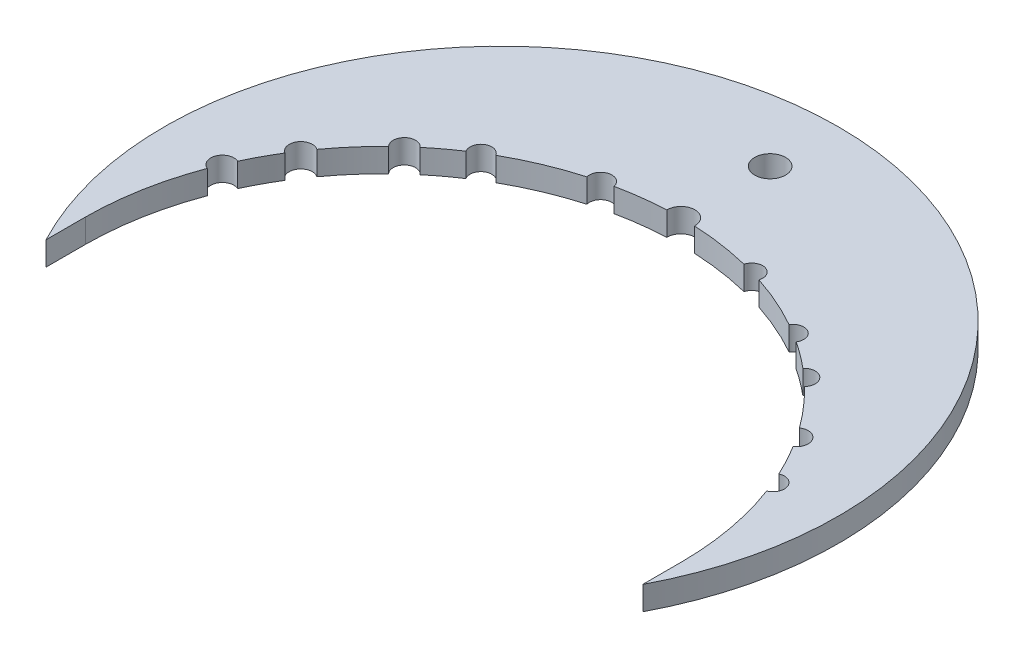
from build123d import *

# Parameters (mm, degrees)
SKETCH1_R           = 3.25
BOSS_EXTRUDE1_DEPTH = 5


with BuildPart() as part:
    # Sketch1 → Boss-Extrude1 (new body)
    with BuildSketch(Plane(origin=(0, 0, 0), x_dir=(1, 0, 0), z_dir=(0, 1, 0))):
        with BuildLine():
            Line((-28.542881295, -8.313061402), (-28.542881295, 0))
            ThreePointArc((-28.542881295, 0), (-27.519538444, 11.019859195), (-24.578784895, 21.689277915))
            ThreePointArc((-24.578784895, 21.689277915), (-25.937675328, 24.91196102), (-22.689121079, 26.20778697))
            ThreePointArc((-22.689121079, 26.20778697), (-21.048406581, 29.484341752), (-19.219494859, 32.659690113))
            ThreePointArc((-19.219494859, 32.659690113), (-19.925698686, 36.062690819), (-16.509658786, 36.702854117))
            ThreePointArc((-16.509658786, 36.702854117), (-13.176236592, 40.894611174), (-9.497994033, 44.787304641))
            ThreePointArc((-9.497994033, 44.787304641), (-9.355624409, 48.143317196), (-6.002866021, 47.938132961))
            ThreePointArc((-6.002866021, 47.938132961), (-3.296433606, 50.076759709), (-0.476727814, 52.063656795))
            ThreePointArc((-0.476727814, 52.063656795), (0.25356392, 55.236325904), (3.4124531, 54.448560431))
            ThreePointArc((3.4124531, 54.448560431), (10.007792903, 57.677757851), (16.934820195, 60.115485479))
            ThreePointArc((16.934820195, 60.115485479), (18.652383069, 63.022105065), (21.526164944, 61.250146437))
            ThreePointArc((21.526164944, 61.250146437), (26.425675491, 62.066503806), (31.374357746, 62.493337366))
            ThreePointArc((31.374357746, 62.493337366), (34.295757633, 65.483472004), (37.217157521, 62.493337366))
            ThreePointArc((37.217157521, 62.493337366), (43.358389026, 61.90434517), (49.412267148, 60.715986681))
            ThreePointArc((49.412267148, 60.715986681), (52.271116717, 62.33386505), (53.836364148, 59.445863707))
            ThreePointArc((53.836364148, 59.445863707), (59.631226078, 57.227557226), (65.179062166, 54.448560431))
            ThreePointArc((65.179062166, 54.448560431), (68.337951346, 55.236325904), (69.06824308, 52.063656795))
            ThreePointArc((69.06824308, 52.063656795), (71.887948872, 50.076759709), (74.594381287, 47.938132961))
            ThreePointArc((74.594381287, 47.938132961), (77.947139675, 48.143317196), (78.089509299, 44.787304641))
            ThreePointArc((78.089509299, 44.787304641), (81.767751858, 40.894611174), (85.101174052, 36.702854117))
            ThreePointArc((85.101174052, 36.702854117), (88.517213952, 36.062690819), (87.811010125, 32.659690113))
            ThreePointArc((87.811010125, 32.659690113), (89.655339665, 29.455653908), (91.308059875, 26.148704352))
            ThreePointArc((91.308059875, 26.148704352), (94.469108282, 24.886834286), (93.147498105, 21.750293257))
            ThreePointArc((93.147498105, 21.750293257), (96.105189953, 11.051895391), (97.134396561, 0))
            Line((97.134396561, 0), (97.134396561, -8.313061402))
            ThreePointArc((97.134396561, -8.313061402), (34.295757633, 95.731751458), (-28.542881295, -8.313061402))
        make_face()
        with Locations((34.295757633, 81.337655756)):
            Circle(SKETCH1_R, mode=Mode.SUBTRACT)
    extrude(amount=BOSS_EXTRUDE1_DEPTH)


solid = part.part
